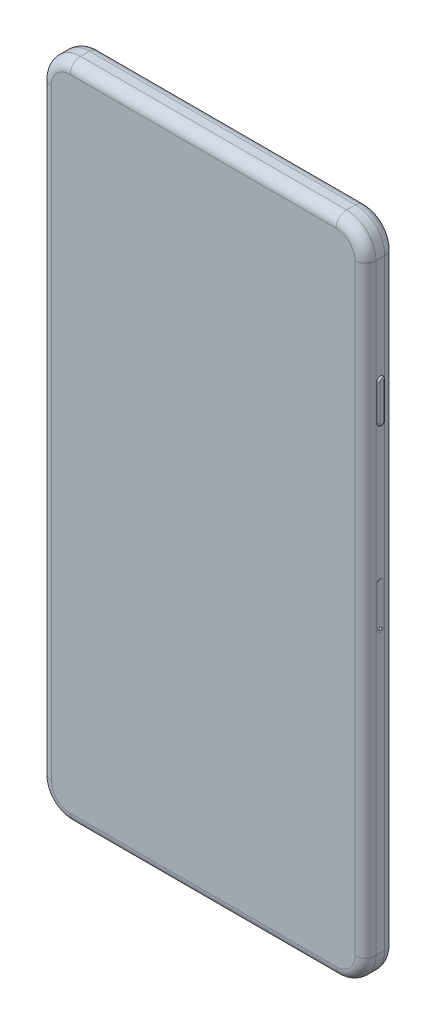
from build123d import *

# Parameters (mm, degrees)
BOSS_EXTRUDE1_DEPTH = 7.1
CUT_EXTRUDE1_DEPTH  = 0.1
FILLET1_R           = 2.5
SKETCH2_R           = 0.676027343
CUT_EXTRUDE3_DEPTH  = 0.3
BOSS_EXTRUDE3_DEPTH = 0.4
FILLET3_R           = 0.4
SKETCH5_R           = 0.35
BOSS_EXTRUDE4_DEPTH = 0.02
CUT_EXTRUDE4_START  = -1
SKETCH6_R           = 0.35
CUT_EXTRUDE4_DEPTH  = 1
BOSS_EXTRUDE5_START = 0.4
BOSS_EXTRUDE5_DEPTH = 0.4
FILLET4_R           = 0.4
CUT_EXTRUDE5_DEPTH  = 0.3
SKETCH10_R          = 0.62
CUT_EXTRUDE6_DEPTH  = 1
SKETCH10_3_R        = 0.5
CUT_EXTRUDE7_DEPTH  = 0.3
BOSS_EXTRUDE6_START = 0.1
BOSS_EXTRUDE6_DEPTH = 0.1


with BuildPart() as part:
    # Sketch1 → Boss-Extrude1 (new body)
    with BuildSketch(Plane.XY):
        with BuildLine():
            Line((-31.7, 78.75), (31.7, 78.75))
            ThreePointArc((31.7, 78.75), (36.649747468, 76.699747468), (38.7, 71.75))
            Line((38.7, 71.75), (38.7, -71.75))
            ThreePointArc((38.7, -71.75), (36.649747468, -76.699747468), (31.7, -78.75))
            Line((31.7, -78.75), (-31.7, -78.75))
            ThreePointArc((-31.7, -78.75), (-36.649747468, -76.699747468), (-38.7, -71.75))
            Line((-38.7, -71.75), (-38.7, 71.75))
            ThreePointArc((-38.7, 71.75), (-36.649747468, 76.699747468), (-31.7, 78.75))
        make_face()
    extrude(amount=-BOSS_EXTRUDE1_DEPTH)

    # Sketch1<3> → Cut-Extrude1 (cut)
    with BuildSketch(Plane.XY):
        with BuildLine():
            Line((-36.2, 71.25), (-36.2, -71.25))
            ThreePointArc((-36.2, -71.25), (-34.735533906, -74.785533906), (-31.2, -76.25))
            Line((-31.2, -76.25), (31.2, -76.25))
            ThreePointArc((31.2, -76.25), (34.735533906, -74.785533906), (36.2, -71.25))
            Line((36.2, -71.25), (36.2, 71.25))
            ThreePointArc((36.2, 71.25), (34.735533906, 74.785533906), (31.2, 76.25))
            Line((31.2, 76.25), (22.375, 76.25))
            ThreePointArc((22.375, 76.25), (22.021446609, 76.103553391), (21.875, 75.75))
            Line((21.875, 75.75), (21.875, 74.4325))
            ThreePointArc((21.875, 74.4325), (20.996320344, 72.311179656), (18.875, 71.4325))
            Line((18.875, 71.4325), (-18.875, 71.4325))
            ThreePointArc((-18.875, 71.4325), (-20.996320344, 72.311179656), (-21.875, 74.4325))
            Line((-21.875, 74.4325), (-21.875, 75.75))
            ThreePointArc((-21.875, 75.75), (-22.021446609, 76.103553391), (-22.375, 76.25))
            Line((-22.375, 76.25), (-31.2, 76.25))
            ThreePointArc((-31.2, 76.25), (-34.735533906, 74.785533906), (-36.2, 71.25))
        make_face()
    extrude(amount=-CUT_EXTRUDE1_DEPTH, mode=Mode.SUBTRACT)

    # Fillet1
    fillet1_edges = [part.edges().sort_by_distance(p)[0] for p in [
        (0, -78.75, 0),
        (-36.649747468, -76.699747468, 0),
        (-38.7, 0, 0),
        (-36.649747468, 76.699747468, 0),
        (-36.649747468, -76.699747468, -7.1),
        (0, -78.75, -7.1),
        (36.649747468, -76.699747468, -7.1),
        (38.7, 0, -7.1),
        (36.649747468, 76.699747468, -7.1),
        (0, 78.75, -7.1),
        (-36.649747468, 76.699747468, -7.1),
        (0, 78.75, 0),
        (-38.7, 0, -7.1),
        (36.649747468, 76.699747468, 0),
        (38.7, 0, 0),
        (36.649747468, -76.699747468, 0),
    ]]
    fillet(fillet1_edges, radius=FILLET1_R - 0.0001)  # a hair under: the kernel refuses the full size

    # Sketch2 → Cut-Extrude3 (cut)
    with BuildSketch(Plane.XY):
        with Locations((7.3325, 73.84125)):
            Circle(SKETCH2_R)
        with BuildLine():
            Line((-4.3825, 74.517277343), (4.3825, 74.517277343))
            ThreePointArc((4.3825, 74.517277343), (5.058527343, 73.84125), (4.3825, 73.165222657))
            Line((4.3825, 73.165222657), (-4.3825, 73.165222657))
            ThreePointArc((-4.3825, 73.165222657), (-5.058527343, 73.84125), (-4.3825, 74.517277343))
        make_face()
    extrude(amount=-CUT_EXTRUDE3_DEPTH, mode=Mode.SUBTRACT)

    # Sketch4 → Boss-Extrude3 (add)
    with BuildSketch(Plane(origin=(38.7, 0, 0), x_dir=(0, 0, -1), z_dir=(1, 0, 0))):
        with BuildLine():
            Line((4.384936965, 46.569932164), (4.384936965, 38.069932164))
            ThreePointArc((4.384936965, 38.069932164), (3.55, 37.234995199), (2.715063035, 38.069932164))
            Line((2.715063035, 38.069932164), (2.715063035, 46.569932164))
            ThreePointArc((2.715063035, 46.569932164), (3.55, 47.404869129), (4.384936965, 46.569932164))
        make_face()
    extrude(amount=BOSS_EXTRUDE3_DEPTH)

    # Fillet3
    fillet3_edges = [part.edges().sort_by_distance(p)[0] for p in [
        (39.1, 42.319932164, -4.384936965),
        (39.1, 37.234995199, -3.55),
        (39.1, 42.319932164, -2.715063035),
        (39.1, 47.404869129, -3.55),
    ]]
    fillet(fillet3_edges, radius=FILLET3_R - 0.0001)  # a hair under: the kernel refuses the full size

    # Sketch5 → Boss-Extrude4 (add)
    with BuildSketch(Plane(origin=(38.7, 0, 0), x_dir=(0, 0, -1), z_dir=(1, 0, 0))):
        with BuildLine():
            Line((2.743081149, -4.75), (2.743081149, 4.75))
            ThreePointArc((2.743081149, 4.75), (3.55, 5.556918851), (4.356918851, 4.75))
            Line((4.356918851, 4.75), (4.356918851, -4.75))
            ThreePointArc((4.356918851, -4.75), (3.55, -5.556918851), (2.743081149, -4.75))
        make_face()
        with Locations(Location((3.55, -4.75, 0), (0, 0, 90))):
            Circle(SKETCH5_R, mode=Mode.SUBTRACT)
    extrude(amount=BOSS_EXTRUDE4_DEPTH)

    # Sketch6 → Cut-Extrude4 (cut)
    with BuildSketch(Plane(origin=(38.7, 0, 0), x_dir=(0, 0, -1), z_dir=(1, 0, 0)).offset(CUT_EXTRUDE4_START)):
        with Locations(Location((3.55, -4.75, 0), (0, 0, 90))):
            Circle(SKETCH6_R)
    extrude(amount=CUT_EXTRUDE4_DEPTH, mode=Mode.SUBTRACT)

    # Sketch7 → Boss-Extrude5 (add)
    with BuildSketch(Plane.ZY.offset(38.7).offset(BOSS_EXTRUDE5_START)):
        with BuildLine():
            Line((-2.715063035, 46.569932164), (-2.715063035, 38.069932164))
            ThreePointArc((-2.715063035, 38.069932164), (-3.55, 37.234995199), (-4.384936965, 38.069932164))
            Line((-4.384936965, 38.069932164), (-4.384936965, 46.569932164))
            ThreePointArc((-4.384936965, 46.569932164), (-3.55, 47.404869129), (-2.715063035, 46.569932164))
        make_face()
        with BuildLine():
            Line((-4.384936965, 34.060277107), (-4.384936965, 25.560277107))
            ThreePointArc((-4.384936965, 25.560277107), (-3.55, 24.725340142), (-2.715063035, 25.560277107))
            Line((-2.715063035, 25.560277107), (-2.715063035, 34.060277107))
            ThreePointArc((-2.715063035, 34.060277107), (-3.55, 34.895214071), (-4.384936965, 34.060277107))
        make_face()
    extrude(amount=-BOSS_EXTRUDE5_DEPTH)

    # Fillet4
    fillet4_edges = [part.edges().sort_by_distance(p)[0] for p in [
        (-39.1, 29.810277107, -4.384936965),
        (-39.1, 34.895214071, -3.55),
        (-39.1, 29.810277107, -2.715063035),
        (-39.1, 24.725340142, -3.55),
        (-39.1, 42.319932164, -2.715063035),
        (-39.1, 37.234995199, -3.55),
        (-39.1, 42.319932164, -4.384936965),
        (-39.1, 47.404869129, -3.55),
    ]]
    fillet(fillet4_edges, radius=FILLET4_R - 0.0001)  # a hair under: the kernel refuses the full size

    # Sketch8 → Cut-Extrude5 (cut)
    with BuildSketch(Plane.ZY.offset(38.7)):
        with BuildLine():
            Line((-4.172186762, 50.653196256), (-4.172186762, 54.153196256))
            ThreePointArc((-4.172186762, 54.153196256), (-3.55, 54.775383019), (-2.927813238, 54.153196256))
            Line((-2.927813238, 54.153196256), (-2.927813238, 50.653196256))
            ThreePointArc((-2.927813238, 50.653196256), (-3.55, 50.031009494), (-4.172186762, 50.653196256))
        make_face()
    extrude(amount=-CUT_EXTRUDE5_DEPTH, mode=Mode.SUBTRACT)

    # Sketch10 → Cut-Extrude6 (cut)
    with BuildSketch(Plane.XZ.offset(78.75)):
        with Locations(Location((-26.7, -3.499791078, 0), (0, 0, 270))):
            Circle(SKETCH10_R)
        with Locations(Location((-24.7, -3.499791078, 0), (0, 0, 270))):
            Circle(SKETCH10_R)
        with Locations(Location((-22.7, -3.499791078, 0), (0, 0, 270))):
            Circle(SKETCH10_R)
        with Locations(Location((-20.7, -3.499791078, 0), (0, 0, 270))):
            Circle(SKETCH10_R)
        with Locations(Location((-18.7, -3.499791078, 0), (0, 0, 270))):
            Circle(SKETCH10_R)
        with BuildLine():
            ThreePointArc((2.416140334, -4.301730287), (2.383697999, -4.323407562), (2.345429656, -4.331019608))
            Line((2.345429656, -4.331019608), (-2.345429656, -4.331019608))
            ThreePointArc((-2.345429656, -4.331019608), (-2.383697999, -4.323407562), (-2.416140334, -4.301730287))
            Line((-2.416140334, -4.301730287), (-2.85756169, -3.86030893))
            ThreePointArc((-2.85756169, -3.86030893), (-2.879238965, -3.827866595), (-2.886851012, -3.789598252))
            Line((-2.886851012, -3.789598252), (-2.886851012, -2.968980392))
            Line((-2.886851012, -2.968980392), (-2.716140334, -2.798269713))
            ThreePointArc((-2.716140334, -2.798269713), (-2.683697999, -2.776592438), (-2.645429656, -2.768980392))
            Line((-2.645429656, -2.768980392), (2.645429656, -2.768980392))
            ThreePointArc((2.645429656, -2.768980392), (2.683697999, -2.776592438), (2.716140334, -2.798269713))
            Line((2.716140334, -2.798269713), (2.886851012, -2.968980392))
            Line((2.886851012, -2.968980392), (2.886851012, -3.789598252))
            ThreePointArc((2.886851012, -3.789598252), (2.879238965, -3.827866595), (2.85756169, -3.86030893))
            Line((2.85756169, -3.86030893), (2.416140334, -4.301730287))
        make_face()
        with Locations(Location((17.250983068, -3.532763518, 0), (0, 0, 270))):
            Circle(SKETCH10_R)
        with Locations(Location((19.250983068, -3.532763518, 0), (0, 0, 270))):
            Circle(SKETCH10_R)
        with Locations(Location((21.250983068, -3.532763518, 0), (0, 0, 270))):
            Circle(SKETCH10_R)
        with Locations(Location((25.250983068, -3.532763518, 0), (0, 0, 270))):
            Circle(SKETCH10_R)
        with Locations(Location((29.250983068, -3.532763518, 0), (0, 0, 270))):
            Circle(SKETCH10_R)
        with Locations(Location((27.250983068, -3.532763518, 0), (0, 0, 270))):
            Circle(SKETCH10_R)
        with Locations(Location((15.250983068, -3.532763518, 0), (0, 0, 270))):
            Circle(SKETCH10_R)
        with Locations(Location((23.250983068, -3.532763518, 0), (0, 0, 270))):
            Circle(SKETCH10_R)
    extrude(amount=-CUT_EXTRUDE6_DEPTH, mode=Mode.SUBTRACT)

    # Sketch10<3> → Cut-Extrude7 (cut)
    with BuildSketch(Plane.XZ.offset(78.75)):
        with Locations(Location((4.911533441, -3.532763518, 0), (0, 0, 270))):
            Circle(SKETCH10_3_R)
        with Locations(Location((-4.911533441, -3.532763518, 0), (0, 0, 90))):
            Circle(SKETCH10_3_R)
    extrude(amount=-CUT_EXTRUDE7_DEPTH, mode=Mode.SUBTRACT)

    # Sketch12 → Boss-Extrude6 (add)
    with BuildSketch(Plane.XY.offset(-0.1).offset(BOSS_EXTRUDE6_START)):
        with BuildLine():
            Line((-22.375, 76.25), (-31.2, 76.25))
            ThreePointArc((-31.2, 76.25), (-34.735533906, 74.785533906), (-36.2, 71.25))
            Line((-36.2, 71.25), (-36.2, -71.25))
            ThreePointArc((-36.2, -71.25), (-34.735533906, -74.785533906), (-31.2, -76.25))
            Line((-31.2, -76.25), (31.2, -76.25))
            ThreePointArc((31.2, -76.25), (34.735533906, -74.785533906), (36.2, -71.25))
            Line((36.2, -71.25), (36.2, 71.25))
            ThreePointArc((36.2, 71.25), (34.735533906, 74.785533906), (31.2, 76.25))
            Line((31.2, 76.25), (22.375, 76.25))
            ThreePointArc((22.375, 76.25), (22.021446609, 76.103553391), (21.875, 75.75))
            Line((21.875, 75.75), (21.875, 74.4325))
            ThreePointArc((21.875, 74.4325), (20.996320344, 72.311179656), (18.875, 71.4325))
            Line((18.875, 71.4325), (-18.875, 71.4325))
            ThreePointArc((-18.875, 71.4325), (-20.996320344, 72.311179656), (-21.875, 74.4325))
            Line((-21.875, 74.4325), (-21.875, 75.75))
            ThreePointArc((-21.875, 75.75), (-22.021446609, 76.103553391), (-22.375, 76.25))
        make_face()
        with BuildLine():
            Line((22.375, 76.25), (-22.375, 76.25))
            ThreePointArc((-22.375, 76.25), (-22.021446609, 76.103553391), (-21.875, 75.75))
            Line((-21.875, 75.75), (-21.875, 74.4325))
            ThreePointArc((-21.875, 74.4325), (-20.996320344, 72.311179656), (-18.875, 71.4325))
            Line((-18.875, 71.4325), (18.875, 71.4325))
            ThreePointArc((18.875, 71.4325), (20.996320344, 72.311179656), (21.875, 74.4325))
            Line((21.875, 74.4325), (21.875, 75.75))
            ThreePointArc((21.875, 75.75), (22.021446609, 76.103553391), (22.375, 76.25))
        make_face()
    extrude(amount=-BOSS_EXTRUDE6_DEPTH)


solid = part.part
